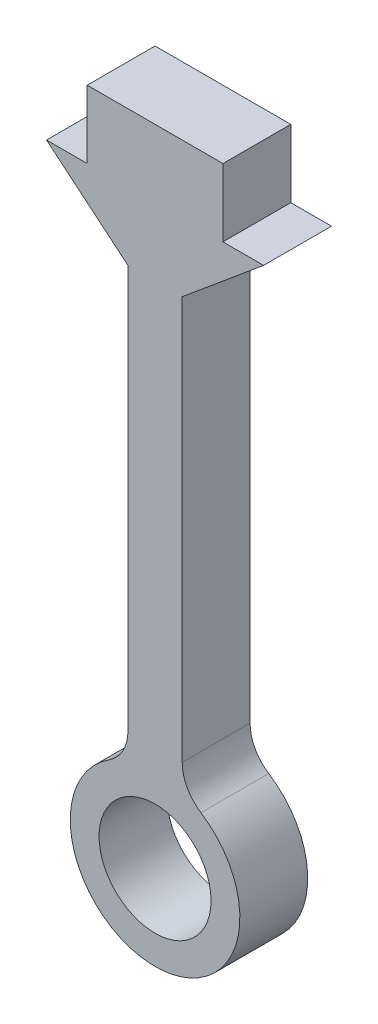
from build123d import *

# Parameters (mm, degrees)
ESQUISSE1_R        = 1.65
BOSS_EXTRU_1_DEPTH = 2
CONG_1_R           = 1.2


with BuildPart() as part:
    # Esquisse1 → Boss.-Extru.1 (new body)
    with BuildSketch(Plane.XY):
        with BuildLine():
            Line((-1.601604278, -1.372264328), (-2.801604278, -1.372264328))
            Line((-2.801604278, -1.372264328), (-0.401604278, -3.372264328))
            Line((-0.401604278, -3.372264328), (-0.401604278, -16.003720472))
            ThreePointArc((-0.401604278, -16.003720472), (0.398395722, -20.872264328), (1.198395722, -16.003720472))
            Line((1.198395722, -16.003720472), (1.198395722, -3.372264328))
            Line((1.198395722, -3.372264328), (3.598395722, -1.372264328))
            Line((3.598395722, -1.372264328), (2.398395722, -1.372264328))
            Line((2.398395722, -1.372264328), (2.398395722, 0.627735672))
            Line((2.398395722, 0.627735672), (-1.601604278, 0.627735672))
            Line((-1.601604278, 0.627735672), (-1.601604278, -1.372264328))
        make_face()
        with Locations((0.398395722, -18.372264328)):
            Circle(ESQUISSE1_R, mode=Mode.SUBTRACT)
    extrude(amount=BOSS_EXTRU_1_DEPTH)

    # Congé1
    cong_1_edges = [part.edges().sort_by_distance(p)[0] for p in [
        (-0.401604278, -16.003720472, 1),
        (1.198395722, -16.003720472, 1),
    ]]
    fillet(cong_1_edges, radius=CONG_1_R)


solid = part.part
